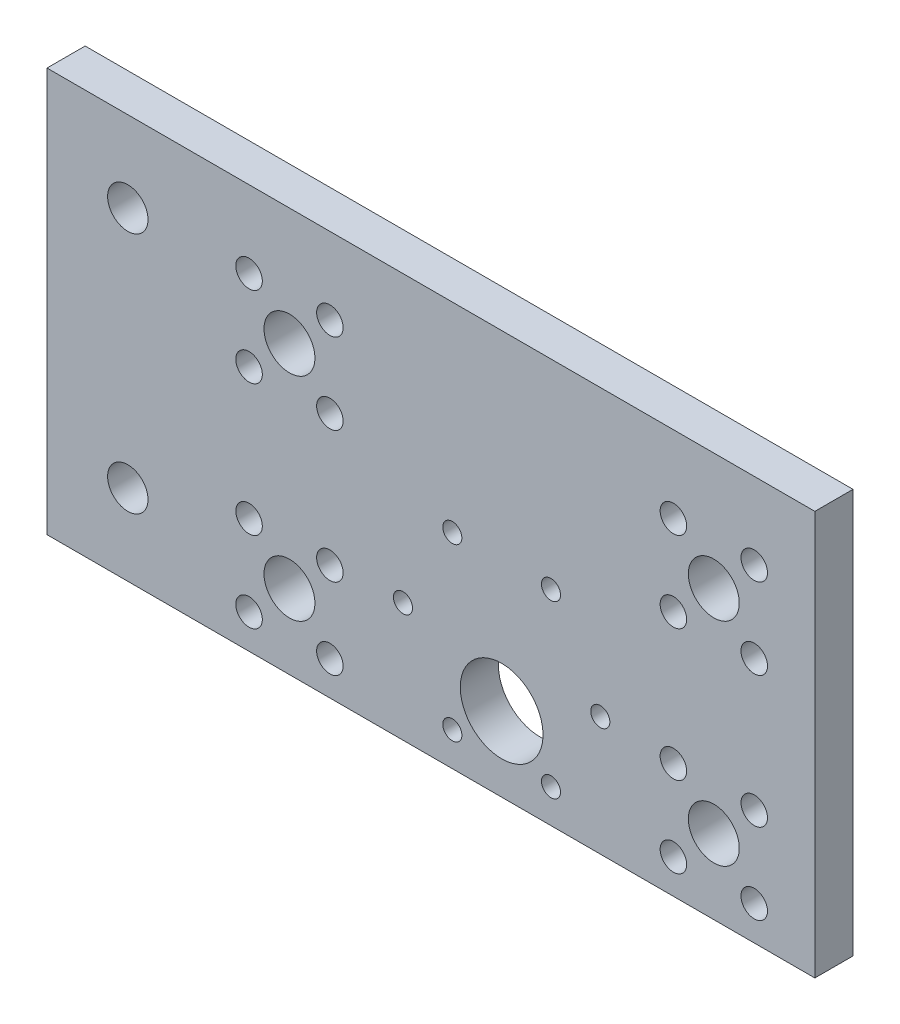
from build123d import *

# Parameters (mm, degrees)
SKETCH1_W           = 120.65
SKETCH1_H           = 63.5
SKETCH1_R           = 6.5
SKETCH1_R_2         = 1.5
SKETCH1_R_3         = 4
SKETCH1_R_4         = 3.175
SKETCH1_R_5         = 2.0828
BOSS_EXTRUDE1_DEPTH = 5.9944


with BuildPart() as part:
    # Sketch1 → Boss-Extrude1 (new body)
    with BuildSketch(Plane.XY):
        with Locations((60.325, 31.75)):
            Rectangle(SKETCH1_W, SKETCH1_H)
        with Locations((71.4375, 11.720625305)):
            Circle(SKETCH1_R, mode=Mode.SUBTRACT)
        with Locations((55.9375, 18.720625305)):
            Circle(SKETCH1_R_2, mode=Mode.SUBTRACT)
        with Locations((86.9375, 18.720625305)):
            Circle(SKETCH1_R_2, mode=Mode.SUBTRACT)
        with Locations((79.1875, 5.297231547)):
            Circle(SKETCH1_R_2, mode=Mode.SUBTRACT)
        with Locations((63.6875, 5.297231547)):
            Circle(SKETCH1_R_2, mode=Mode.SUBTRACT)
        with Locations((63.6875, 32.144019064)):
            Circle(SKETCH1_R_2, mode=Mode.SUBTRACT)
        with Locations((79.1875, 32.144019064)):
            Circle(SKETCH1_R_2, mode=Mode.SUBTRACT)
        with Locations((38.1, 45.070825305)):
            Circle(SKETCH1_R_3, mode=Mode.SUBTRACT)
        with Locations((12.7, 50.8)):
            Circle(SKETCH1_R_4, mode=Mode.SUBTRACT)
        with Locations((12.7, 12.7)):
            Circle(SKETCH1_R_4, mode=Mode.SUBTRACT)
        with Locations((104.775, 45.070825305)):
            Circle(SKETCH1_R_3, mode=Mode.SUBTRACT)
        with Locations((104.775, 11.720625305)):
            Circle(SKETCH1_R_3, mode=Mode.SUBTRACT)
        with Locations((38.1, 11.720625305)):
            Circle(SKETCH1_R_3, mode=Mode.SUBTRACT)
        with Locations((31.75, 18.070625305)):
            Circle(SKETCH1_R_5, mode=Mode.SUBTRACT)
        with Locations((31.75, 5.370625305)):
            Circle(SKETCH1_R_5, mode=Mode.SUBTRACT)
        with Locations((44.45, 5.370625305)):
            Circle(SKETCH1_R_5, mode=Mode.SUBTRACT)
        with Locations((44.45, 18.070625305)):
            Circle(SKETCH1_R_5, mode=Mode.SUBTRACT)
        with Locations((31.75, 51.420825305)):
            Circle(SKETCH1_R_5, mode=Mode.SUBTRACT)
        with Locations((31.75, 38.720825305)):
            Circle(SKETCH1_R_5, mode=Mode.SUBTRACT)
        with Locations((44.45, 38.720825305)):
            Circle(SKETCH1_R_5, mode=Mode.SUBTRACT)
        with Locations((44.45, 51.420825305)):
            Circle(SKETCH1_R_5, mode=Mode.SUBTRACT)
        with Locations((98.425, 51.420825305)):
            Circle(SKETCH1_R_5, mode=Mode.SUBTRACT)
        with Locations((98.425, 38.720825305)):
            Circle(SKETCH1_R_5, mode=Mode.SUBTRACT)
        with Locations((111.125, 38.720825305)):
            Circle(SKETCH1_R_5, mode=Mode.SUBTRACT)
        with Locations((111.125, 51.420825305)):
            Circle(SKETCH1_R_5, mode=Mode.SUBTRACT)
        with Locations((98.425, 18.070625305)):
            Circle(SKETCH1_R_5, mode=Mode.SUBTRACT)
        with Locations((98.425, 5.370625305)):
            Circle(SKETCH1_R_5, mode=Mode.SUBTRACT)
        with Locations((111.125, 5.370625305)):
            Circle(SKETCH1_R_5, mode=Mode.SUBTRACT)
        with Locations((111.125, 18.070625305)):
            Circle(SKETCH1_R_5, mode=Mode.SUBTRACT)
    extrude(amount=BOSS_EXTRUDE1_DEPTH)


solid = part.part
